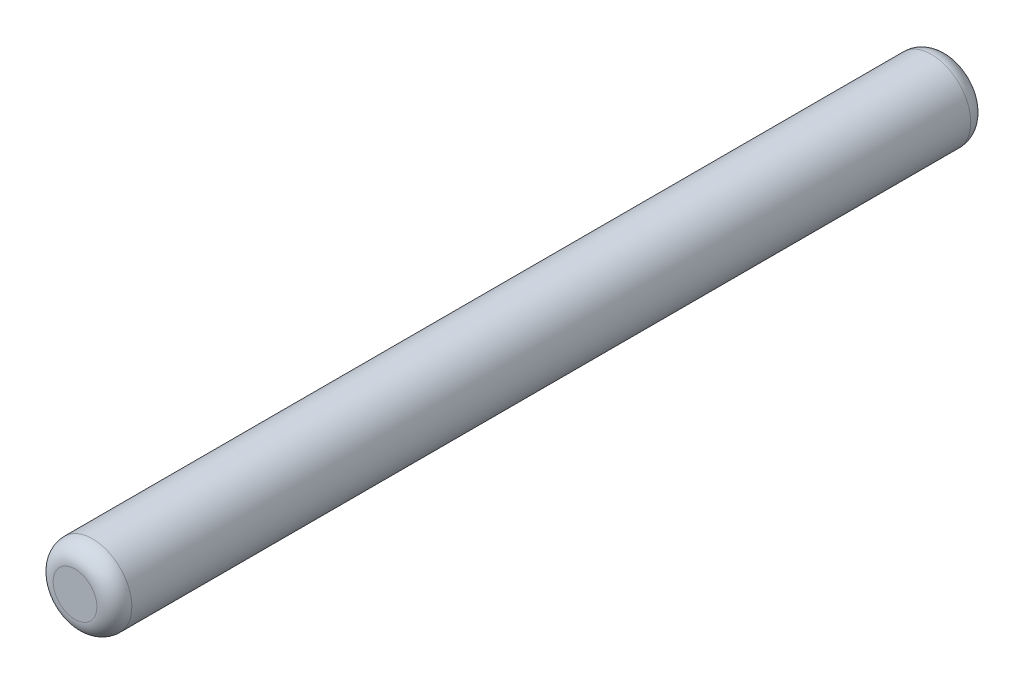
from build123d import *

# Parameters (mm, degrees)
SKETCH_1_R      = 1.8
EXTRUDE_1_DEPTH = 40
FILLET_1_R      = 0.8


with BuildPart() as part:
    # 스케치1 → 보스-돌출1 (new body)
    with BuildSketch(Plane.XY):
        Circle(SKETCH_1_R)
    extrude(amount=EXTRUDE_1_DEPTH)

    # 필렛1
    fillet_1_edges = [part.edges().sort_by_distance(p)[0] for p in [
        (-1.8, 0, 0),
        (-1.8, 0, 40),
    ]]
    fillet(fillet_1_edges, radius=FILLET_1_R)


solid = part.part
